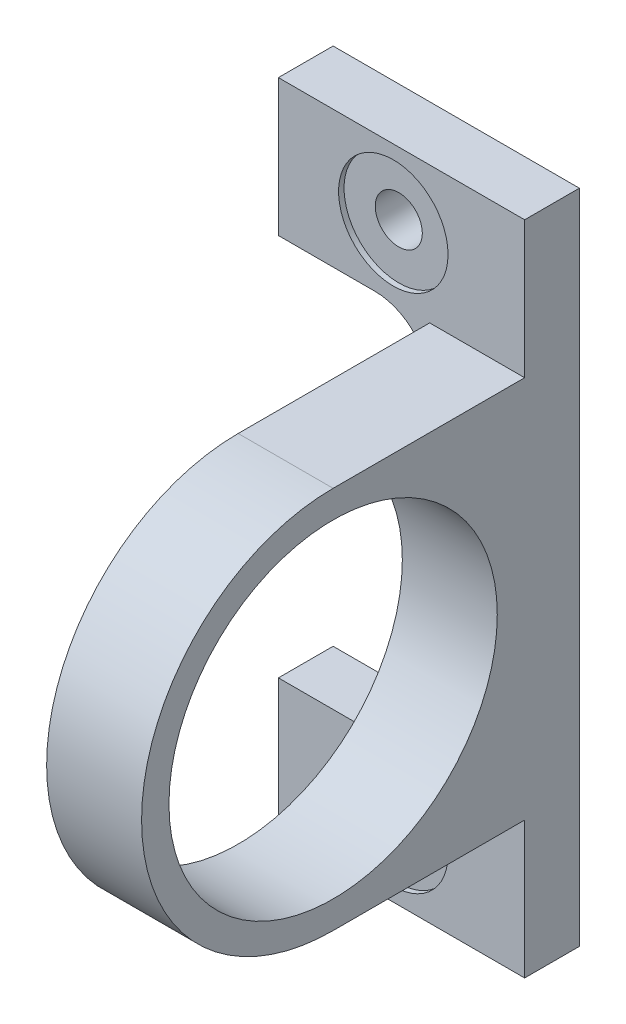
from build123d import *

# Parameters (mm, degrees)
SKETCH_2_W                     = 45
SKETCH_2_H                     = 60
SKETCH_2_W_2                   = 27.647058823
SKETCH_2_H_2                   = 35
EXTRUDE_2_DEPTH                = 5
SKETCH_4_W                     = 8.676470589
SKETCH_4_H                     = 35
SKETCH_4_W_2                   = 8.676470588
EXTRUDE_15_DEPTH               = 35
CUT_EXTRUDE_1_DEPTH            = 45
SKETCH_6_R                     = 15
CUT_EXTRUDE_2_DEPTH            = 45
FILLET_1_R                     = 5
EXTRUDE_START                  = -1
SKETCH_7_R                     = 15
SKETCH_7_R_2                   = 13
EXTRUDE_16_DEPTH               = 1
SPLIT_BODIES_1_SURFACE_1_BACK  = 86
SPLIT_BODIES_1_SURFACE_1_DEPTH = 172
SPLIT_BODIES_1_SURFACE_2_BACK  = 86
SPLIT_BODIES_1_SURFACE_2_DEPTH = 172
HOLE_WIZARD_1_D                = 4.3
HOLE_WIZARD_1_DEPTH            = 5
HOLE_WIZARD_1_CBORE_D          = 10
HOLE_WIZARD_1_CBORE_DEPTH      = 0.5
HOLE_WIZARD_1_TIP              = 1.291850331


with BuildPart() as part:
    # 草图2 → 凸台-拉伸2 (new body)
    with BuildSketch(Plane.XY):
        with Locations((7.726423565, -5.661764706)):
            Rectangle(SKETCH_2_W, SKETCH_2_H)
        with Locations((7.726423565, -5.661764706)):
            Rectangle(SKETCH_2_W_2, SKETCH_2_H_2, mode=Mode.SUBTRACT)
    extrude(amount=EXTRUDE_2_DEPTH)

    # 草图4 → 凸台-拉伸15 (add)
    with BuildSketch(Plane.XY.offset(5)):
        with Locations((-10.435341141, -5.661764706)):
            Rectangle(SKETCH_4_W, SKETCH_4_H)
        with Locations((25.888188271, -5.661764706)):
            Rectangle(SKETCH_4_W_2, SKETCH_4_H)
    extrude(amount=EXTRUDE_15_DEPTH)

    # 草图5 → 切除-拉伸1 (cut)
    with BuildSketch(Plane.ZY.offset(14.773576435)):
        with BuildLine():
            ThreePointArc((22.5, 11.838235294), (34.874368671, 6.712603965), (40, -5.661764706))
            Line((40, -5.661764706), (40, 11.838235294))
            Line((40, 11.838235294), (22.5, 11.838235294))
        make_face()
        with BuildLine():
            Line((40, -23.161764706), (40, -5.661764706))
            ThreePointArc((40, -5.661764706), (34.874368671, -18.036133377), (22.5, -23.161764706))
            Line((22.5, -23.161764706), (40, -23.161764706))
        make_face()
    extrude(amount=-CUT_EXTRUDE_1_DEPTH, mode=Mode.SUBTRACT)

    # 草图6 → 切除-拉伸2 (cut)
    with BuildSketch(Plane.ZY.offset(14.773576435)):
        with Locations((22.5, -5.661764706)):
            Circle(SKETCH_6_R)
    extrude(amount=-CUT_EXTRUDE_2_DEPTH, mode=Mode.SUBTRACT)

    # 圆角1
    fillet_1_edges = [part.edges().sort_by_distance(p)[0] for p in [
        (-6.097105846, 11.838235294, 2.5),
        (21.549952977, 11.838235294, 2.5),
        (-6.097105846, -23.161764706, 2.5),
        (21.549952977, -23.161764706, 2.5),
    ]]
    fillet(fillet_1_edges, radius=FILLET_1_R)

    # 草图7 → 凸台-拉伸16 (add)
    with BuildSketch(Plane(origin=(-6.097105846, 0, 0), x_dir=(0, 0, -1), z_dir=(1, 0, 0)).offset(EXTRUDE_START)):
        with Locations((-22.5, -5.661764706)):
            Circle(SKETCH_7_R)
        with Locations((-22.5, -5.661764706)):
            Circle(SKETCH_7_R_2, mode=Mode.SUBTRACT)
    extrude(amount=EXTRUDE_16_DEPTH)


with BuildPart() as body_2:
    # Split Bodies 1: the piece behind the surface
    add(part.part)
    # Split Bodies 1 surface: a surface, the sketch's curves swept straight by 172 mm
    with BuildLine(Plane.XY.offset(5).offset(-SPLIT_BODIES_1_SURFACE_1_BACK), mode=Mode.PRIVATE) as split_bodies_1_surface_1_path:
        Line((7.726423565, 24.338235294), (7.726423565, -35.661764706))
    split_bodies_1_surface_1 = Shell.extrude(split_bodies_1_surface_1_path.wire(), (0 * SPLIT_BODIES_1_SURFACE_1_DEPTH, 0 * SPLIT_BODIES_1_SURFACE_1_DEPTH, 1 * SPLIT_BODIES_1_SURFACE_1_DEPTH))
    split(bisect_by=split_bodies_1_surface_1, keep=Keep.BOTTOM)


with BuildPart() as part_1:
    add(part.part)

    # Split Bodies 1: split by a surface, the side it looks to stays
    # Split Bodies 1 surface: a surface, the sketch's curves swept straight by 172 mm
    with BuildLine(Plane.XY.offset(5).offset(-SPLIT_BODIES_1_SURFACE_2_BACK), mode=Mode.PRIVATE) as split_bodies_1_surface_2_path:
        Line((7.726423565, 24.338235294), (7.726423565, -35.661764706))
    split_bodies_1_surface_2 = Shell.extrude(split_bodies_1_surface_2_path.wire(), (0 * SPLIT_BODIES_1_SURFACE_2_DEPTH, 0 * SPLIT_BODIES_1_SURFACE_2_DEPTH, 1 * SPLIT_BODIES_1_SURFACE_2_DEPTH))
    split(bisect_by=split_bodies_1_surface_2, keep=Keep.TOP)

    # 打孔尺寸(%根据六角头螺)栓 全螺纹的类型1
    with Locations(Plane(origin=(18.226423565, 18.088235294, 5), x_dir=(1, 0, 0), z_dir=(0, 0, 1))):
        with Locations((0, 0), (0, -47.5)):
            CounterBoreHole(HOLE_WIZARD_1_D / 2, HOLE_WIZARD_1_CBORE_D / 2, HOLE_WIZARD_1_CBORE_DEPTH, depth=HOLE_WIZARD_1_DEPTH)
            with Locations((0, 0, -(HOLE_WIZARD_1_DEPTH + HOLE_WIZARD_1_TIP / 2))):  # 118° drill point
                Cone(0, HOLE_WIZARD_1_D / 2, HOLE_WIZARD_1_TIP, mode=Mode.SUBTRACT)


solid = part_1.part
